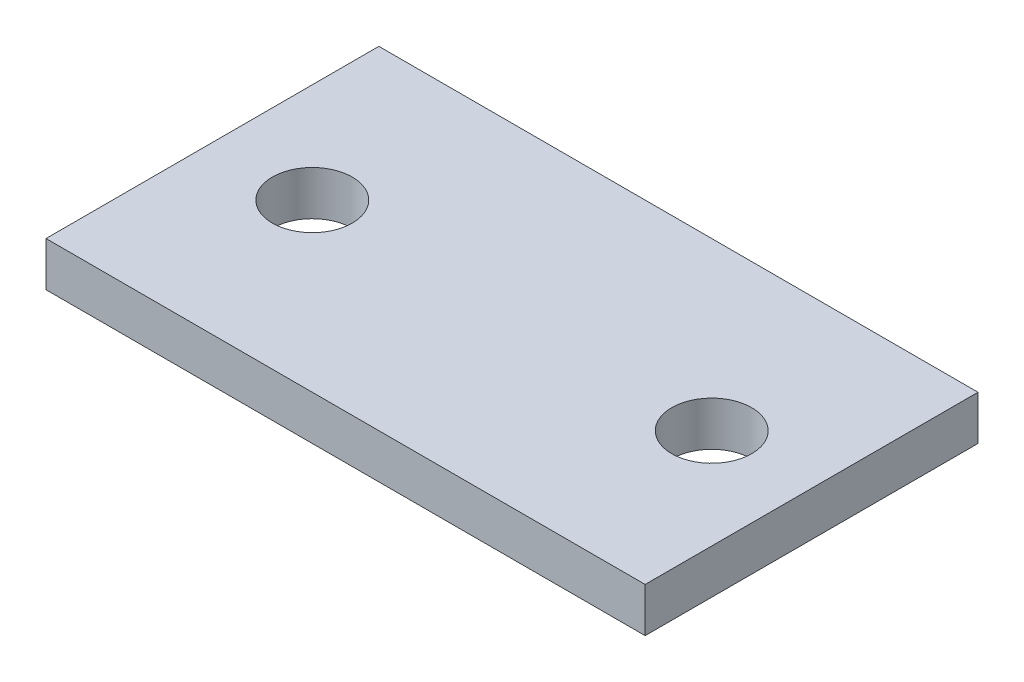
from build123d import *

# Parameters (mm, degrees)
ESQUISSE1_W        = 13.5
ESQUISSE1_H        = 7.5
ESQUISSE1_R        = 0.9
BOSS_EXTRU_1_DEPTH = 1


with BuildPart() as part:
    # Esquisse1 → Boss.-Extru.1 (new body)
    with BuildSketch(Plane(origin=(0, 0, 0), x_dir=(1, 0, 0), z_dir=(0, 1, 0))):
        Rectangle(ESQUISSE1_W, ESQUISSE1_H)
        with Locations((-4.5, 0)):
            Circle(ESQUISSE1_R, mode=Mode.SUBTRACT)
        with Locations((4.5, 0)):
            Circle(ESQUISSE1_R, mode=Mode.SUBTRACT)
    extrude(amount=BOSS_EXTRU_1_DEPTH)


solid = part.part
